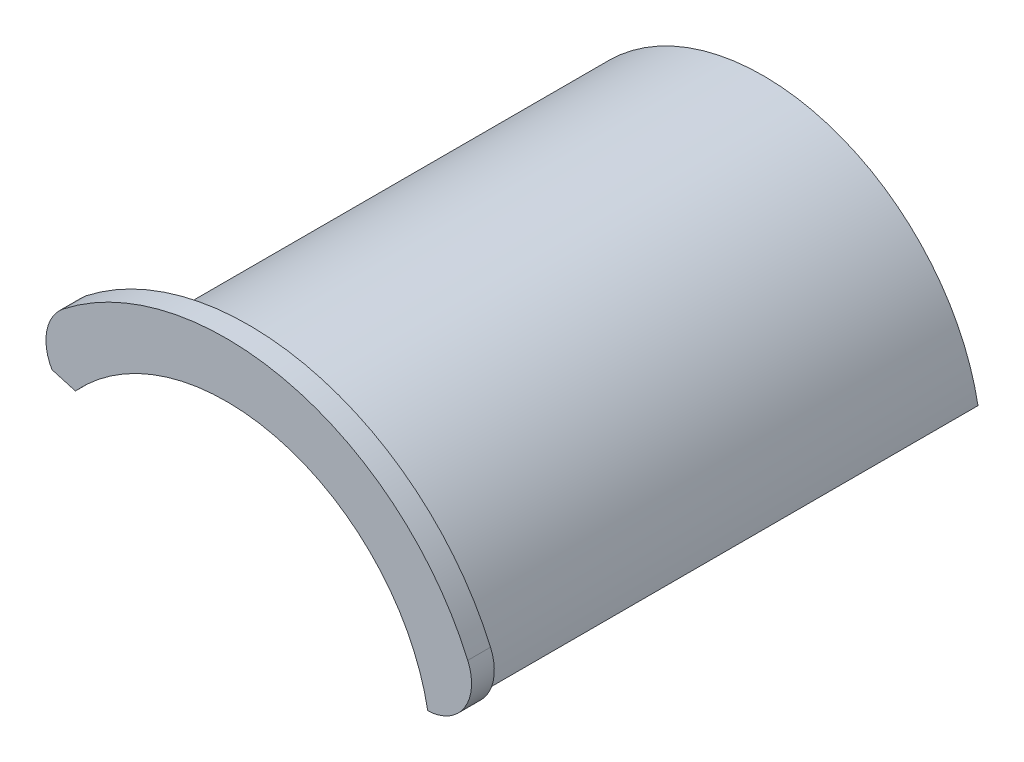
from build123d import *

# Parameters (mm, degrees)
BOSS_EXTRU_1_DEPTH      = 118
BOSS_EXTRU_2_START      = -5
BOSS_EXTRU_2_DEPTH      = 5
CONG_1_R                = 5
ENL_V_MAT_EXTRU_2_DEPTH = 144.326668003
CONG_2_R                = 10
CONG_3_START            = -1
CONG_3_DEPTH            = 119


with BuildPart() as part:
    # Esquisse1 → Boss.-Extru.1 (new body)
    with BuildSketch(Plane.XY):
        with BuildLine():
            Line((-48, 0), (-44.998214382, -0.400877025))
            ThreePointArc((-44.998214382, -0.400877025), (5.956695581, 44.604010781), (43.316094217, -12.194916228))
            Line((43.316094217, -12.194916228), (46.317879834, -12.595793253))
            ThreePointArc((46.317879834, -12.595793253), (6.35380862, 47.5776115), (-48, 0))
        make_face()
    extrude(amount=BOSS_EXTRU_1_DEPTH)

    # Esquisse2 → Boss.-Extru.2 (add)
    with BuildSketch(Plane.XY.offset(118).offset(BOSS_EXTRU_2_START)):
        with BuildLine():
            Line((-58.058892958, 1.511889338), (-47.999984368, 0.038739081))
            ThreePointArc((-47.999984368, 0.038739081), (6.373007198, 47.57504366), (46.317879834, -12.595793253))
            Line((46.317879834, -12.595793253), (43.316094217, -12.194916228))
            Line((43.316094217, -12.194916228), (56.371627647, -14.179393207))
            ThreePointArc((56.371627647, -14.179393207), (7.76570592, 56.450860633), (-58.058892958, 1.511889338))
        make_face()
    extrude(amount=BOSS_EXTRU_2_DEPTH)

    # Congé1
    cong_1_edges = [part.edges().sort_by_distance(p)[0] for p in [
        (6.373007198, 47.57504366, 113),
    ]]
    fillet(cong_1_edges, radius=CONG_1_R)

    # Esquisse4 → Enlèv. mat.-Extru.2 (cut, through all)
    with BuildSketch(Plane(origin=(0, 0, 0), x_dir=(-1, 0, 0), z_dir=(0, 0, -1))):
        with BuildLine():
            ThreePointArc((-43.316094217, -12.194916228), (-44.953602713, -2.042939819), (-44.243666063, 8.215717453))
            Line((-44.243666063, 8.215717453), (-47.362132256, 7.799258183))
            ThreePointArc((-47.362132256, 7.799258183), (-47.93720577, -2.454445548), (-46.317879834, -12.595793253))
            Line((-46.317879834, -12.595793253), (-43.316094217, -12.194916228))
        make_face()
        with BuildLine():
            Line((33.208512529, 30.367658711), (-44.243666063, 8.215717453))
            ThreePointArc((-44.243666063, 8.215717453), (-44.953602713, -2.042939819), (-43.316094217, -12.194916228))
            Line((-43.316094217, -12.194916228), (-46.317879834, -12.595793253))
            ThreePointArc((-46.317879834, -12.595793253), (-47.93720577, -2.454445548), (-47.362132256, 7.799258183))
            Line((-47.362132256, 7.799258183), (-114.354421373, -1.147306612))
            Line((-114.354421373, -1.147306612), (-106.599475071, -56.082579824))
            Line((-106.599475071, -56.082579824), (62.827216074, -36.566785192))
            Line((62.827216074, -36.566785192), (101.490219992, -28.614943218))
            Line((101.490219992, -28.614943218), (87.117247585, 24.85835748))
            Line((87.117247585, 24.85835748), (83.033473236, 40.051658321))
            Line((83.033473236, 40.051658321), (38.369226529, 31.843664105))
            Line((38.369226529, 31.843664105), (36.40632276, 31.28225796))
            ThreePointArc((36.40632276, 31.28225796), (45.008351961, 16.680774975), (48, 0))
            Line((48, 0), (44.998214382, -0.400877025))
            ThreePointArc((44.998214382, -0.400877025), (42.020813074, 16.101281583), (33.208512529, 30.367658711))
        make_face()
        with BuildLine():
            Line((36.186144751, 31.219285292), (33.208512529, 30.367658711))
            ThreePointArc((33.208512529, 30.367658711), (42.020813074, 16.101281583), (44.998214382, -0.400877025))
            Line((44.998214382, -0.400877025), (48, 0))
            ThreePointArc((48, 0), (45.008351961, 16.680774975), (36.40632276, 31.28225796))
            Line((36.40632276, 31.28225796), (36.186144751, 31.219285292))
        make_face()
    extrude(amount=-ENL_V_MAT_EXTRU_2_DEPTH, mode=Mode.SUBTRACT)

    # Congé2
    # the kernel refuses this fillet: 10 mm, written as the material it takes off along each edge
    with BuildSketch(Plane(origin=(-46.806940355, 33.394271389, 157.328464208), x_dir=(0.6968989711094409, 0.7171693133888278, 0), z_dir=(0, 0, -1))) as cong_2_piece_1:
        with BuildLine():
            CenterArc((14.375231745, 9.907615581), CONG_2_R, 196.115404214, 81.678802413)
            Line((4.768186123, 7.131886052), (4.57604521, 7.076371462))
            ThreePointArc((4.57604521, 7.076371462), (2.21782943, 3.677102393), (-0.166263631, 0.111159367))
            Line((-0.166263631, 0.111159367), (-0.027123079, -0.198152312))
            ThreePointArc((-0.027123079, -0.198152312), (7.865692842, -0.735829632), (15.758508762, -0.198152312))
            Line((15.758508762, -0.198152312), (15.731385683, 0))
        make_face()
    extrude(amount=83.656928416, mode=Mode.SUBTRACT)

    # Congé3: read off the stored shape, not the designer's step
    # Congé3 outline → Congé3 (cut)
    with BuildSketch(Plane.XY.offset(CONG_3_START)):
        with BuildLine():
            ThreePointArc((57.403173546, 6.458315401), (55.776215181, 14.490369578), (53.03343531, 22.212936923))
            ThreePointArc((53.03343531, 22.212936923), (52.338794722, 12.890702035), (44.243666063, 8.215717453))
            Line((44.243666063, 8.215717453), (57.403173546, 6.458315401))
        make_face()
    extrude(amount=CONG_3_DEPTH, mode=Mode.SUBTRACT)


solid = part.part
